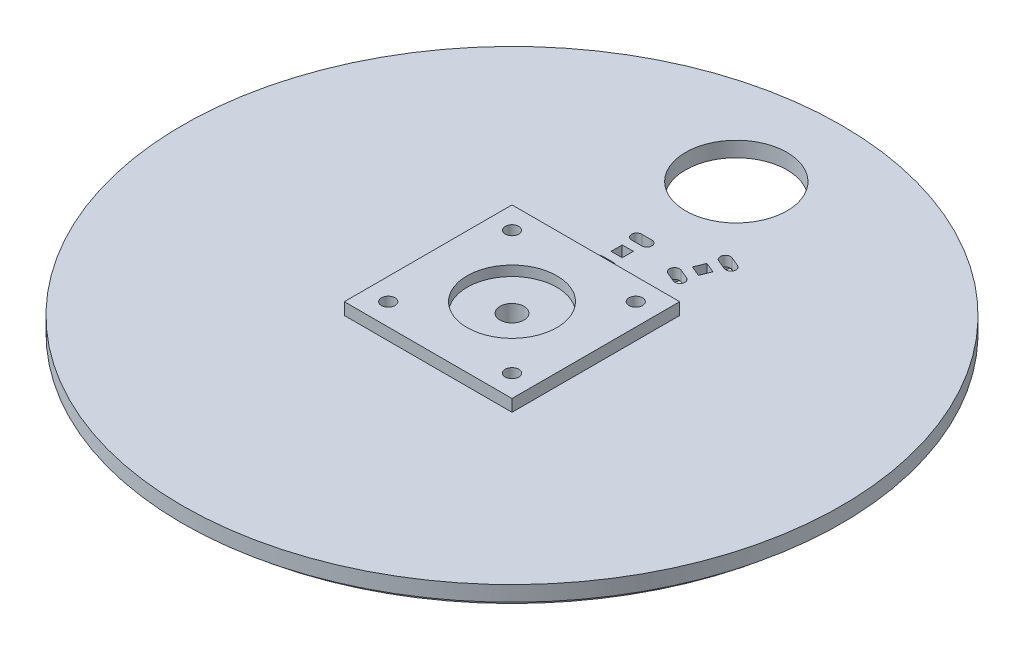
from build123d import *

# Parameters (mm, degrees)
SKETCH1_R                       = 82.55
BOSS_EXTRUDE1_DEPTH             = 3.81
HOLE1_OUTLINE_R                 = 12.7
HOLE1_DEPTH                     = 3.81
BOSS_EXTRUDE2_START             = 0.0254
SKETCH3_R                       = 82.55
SKETCH3_R_2                     = 78.74
BOSS_EXTRUDE2_DEPTH             = 0.0254
SKETCH4_R                       = 6
BOSS_EXTRUDE3_DEPTH             = 1.27
SKETCH5_R                       = 3.75
BOSS_EXTRUDE4_DEPTH             = 6
SKETCH7_W                       = 42
SKETCH7_H                       = 42
BOSS_EXTRUDE5_DEPTH             = 3
SKETCH8_R                       = 11.25
CUT_EXTRUDE2_DEPTH              = 2.5
CUT_EXTRUDE1_DEPTH              = 118.267947027
CUT_EXTRUDE1_DEPTH_BACK         = 118.267947027
SKETCH6_R                       = 3
CBORE_FOR_M3_SBHCS1_D           = 3.4
CBORE_FOR_M3_SBHCS1_CBORE_D     = 6.7
CBORE_FOR_M3_SBHCS1_CBORE_DEPTH = 1.65
SKETCH12_W                      = 6.604
SKETCH12_H                      = 13.462
CUT_EXTRUDE3_DEPTH              = 1.27
SKETCH13_W                      = 2.794
SKETCH13_H                      = 2.794
CUT_EXTRUDE4_DEPTH              = 2.794
CUT_EXTRUDE5_DEPTH              = 118.05527156


# Read off the part's stored shape, not the designer's step: Hole1, Lip1
with BuildPart() as part:
    # Sketch1 → Boss-Extrude1 (new body)
    with BuildSketch(Plane(origin=(0, 0, 0), x_dir=(1, 0, 0), z_dir=(0, 1, 0))):
        with Locations(Location((0, 0, 0), (0, 0, 90))):
            Circle(SKETCH1_R)
    extrude(amount=BOSS_EXTRUDE1_DEPTH)

    # Hole1 outline → Hole1 (cut)
    with BuildSketch(Plane(origin=(0, 0, 0), x_dir=(1, 0, 0), z_dir=(0, 1, 0))):
        with Locations((-0.958051057, 57.141969149)):
            Circle(HOLE1_OUTLINE_R)
    extrude(amount=HOLE1_DEPTH, mode=Mode.SUBTRACT)

    # Sketch3 → Boss-Extrude2 (add)
    with BuildSketch(Plane.XZ.offset(BOSS_EXTRUDE2_START)):
        with Locations(Location((0, 0, 0), (0, 0, 270))):
            Circle(SKETCH3_R)
        with Locations(Location((0, 0, 0), (0, 0, 270))):
            Circle(SKETCH3_R_2, mode=Mode.SUBTRACT)
    extrude(amount=-BOSS_EXTRUDE2_DEPTH)

    # Lip1 outline → Lip1 (revolve)
    with BuildSketch(Plane.XY):
        Polygon((78.74, -0.0254), (78.74, -1.8034), (80.424818968, -1.8034), (80.518, -0.0254), align=None)
    revolve(axis=Axis((0, 0, 0), (0, 1, 0)))

    # Sketch4 → Boss-Extrude3 (add)
    with BuildSketch(Plane.XZ):
        with Locations(Location((0, 0, 0), (0, 0, 90))):
            Circle(SKETCH4_R)
    extrude(amount=BOSS_EXTRUDE3_DEPTH)

    # Sketch5 → Boss-Extrude4 (add)
    with BuildSketch(Plane.XZ.offset(1.27)):
        with Locations(Location((0, 0, 0), (0, 0, 270))):
            Circle(SKETCH5_R)
    extrude(amount=BOSS_EXTRUDE4_DEPTH)

    # Sketch7 → Boss-Extrude5 (add)
    with BuildSketch(Plane(origin=(0, 3.81, 0), x_dir=(1, 0, 0), z_dir=(0, 1, 0))):
        Rectangle(SKETCH7_W, SKETCH7_H)
    extrude(amount=BOSS_EXTRUDE5_DEPTH)

    # Sketch8 → Cut-Extrude2 (cut)
    with BuildSketch(Plane(origin=(0, 6.81, 0), x_dir=(1, 0, 0), z_dir=(0, 1, 0))):
        with Locations(Location((0, 0, 0), (0, 0, 270))):
            Circle(SKETCH8_R)
    extrude(amount=-CUT_EXTRUDE2_DEPTH, mode=Mode.SUBTRACT)

    # Sketch6 → Cut-Extrude1 (cut, two sides: drawn at the far end of the back side and taken through both)
    with BuildSketch(Plane(origin=(0, 3.81, 0), x_dir=(1, 0, 0), z_dir=(0, 1, 0)).offset(-CUT_EXTRUDE1_DEPTH_BACK)):
        with Locations(Location((0, 0, 0), (0, 0, 270))):
            Circle(SKETCH6_R)
    extrude(amount=CUT_EXTRUDE1_DEPTH + CUT_EXTRUDE1_DEPTH_BACK, mode=Mode.SUBTRACT)

    # CBORE for M3 SBHCS1 (through all)
    with Locations(Plane(origin=(0, 0, 0), x_dir=(-1, 0, 0), z_dir=(0, -1, 0))):
        with Locations((-15.5, 15.5), (-15.5, -15.5), (15.5, -15.5), (15.5, 15.5)):
            CounterBoreHole(CBORE_FOR_M3_SBHCS1_D / 2, CBORE_FOR_M3_SBHCS1_CBORE_D / 2, CBORE_FOR_M3_SBHCS1_CBORE_DEPTH)

    # Sketch12 → Cut-Extrude3 (cut)
    with BuildSketch(Plane.XZ):
        with Locations((-0.114811482, -27.731)):
            Rectangle(SKETCH12_W, SKETCH12_H)
        Polygon((13.368272935, -41.371347413), (19.479984235, -38.869387984), (14.379836168, -26.410899564), (8.268124867, -28.912858993), align=None)
    extrude(amount=-CUT_EXTRUDE3_DEPTH, mode=Mode.SUBTRACT)

    # Sketch13 → Cut-Extrude4 (cut)
    with BuildSketch(Plane.XZ.offset(-1.27)):
        with Locations((-0.114811482, -27.731)):
            Rectangle(SKETCH13_W, SKETCH13_H)
        Polygon((13.110453194, -35.713246143), (12.051931897, -33.127522131), (14.637655908, -32.069000834), (15.696177205, -34.654724846), align=None)
    extrude(amount=-CUT_EXTRUDE4_DEPTH, mode=Mode.SUBTRACT)

    # Sketch14 → Cut-Extrude5 (cut, through all)
    with BuildSketch(Plane.XZ.offset(-1.27)):
        with BuildLine():
            Line((1.155188518, -33.8905), (-1.384811482, -33.8905))
            ThreePointArc((-1.384811482, -33.8905), (-2.654811482, -32.6205), (-1.384811482, -31.3505))
            Line((-1.384811482, -31.3505), (1.155188518, -31.3505))
            ThreePointArc((1.155188518, -31.3505), (2.425188518, -32.6205), (1.155188518, -33.8905))
        make_face()
        with BuildLine():
            Line((-1.392065738, -21.683846113), (1.147892825, -21.669337601))
            ThreePointArc((1.147892825, -21.669337601), (2.425126363, -22.932062627), (1.162401338, -24.209296164))
            Line((1.162401338, -24.209296164), (-1.377557226, -24.223804677))
            ThreePointArc((-1.377557226, -24.223804677), (-2.654790763, -22.961079651), (-1.392065738, -21.683846113))
        make_face()
        with BuildLine():
            Line((10.365167141, -28.671923416), (12.715825333, -27.709631328))
            ThreePointArc((12.715825333, -27.709631328), (14.372300474, -28.40381438), (13.678117422, -30.06028952))
            Line((13.678117422, -30.06028952), (11.327459229, -31.022581609))
            ThreePointArc((11.327459229, -31.022581609), (9.670984089, -30.328398556), (10.365167141, -28.671923416))
        make_face()
        with BuildLine():
            Line((15.032283769, -40.072615649), (17.382941961, -39.110323561))
            ThreePointArc((17.382941961, -39.110323561), (18.077125013, -37.453848421), (16.420649873, -36.759665368))
            Line((16.420649873, -36.759665368), (14.069991681, -37.721957457))
            ThreePointArc((14.069991681, -37.721957457), (13.375808628, -39.378432597), (15.032283769, -40.072615649))
        make_face()
    extrude(amount=-CUT_EXTRUDE5_DEPTH, mode=Mode.SUBTRACT)


solid = part.part
